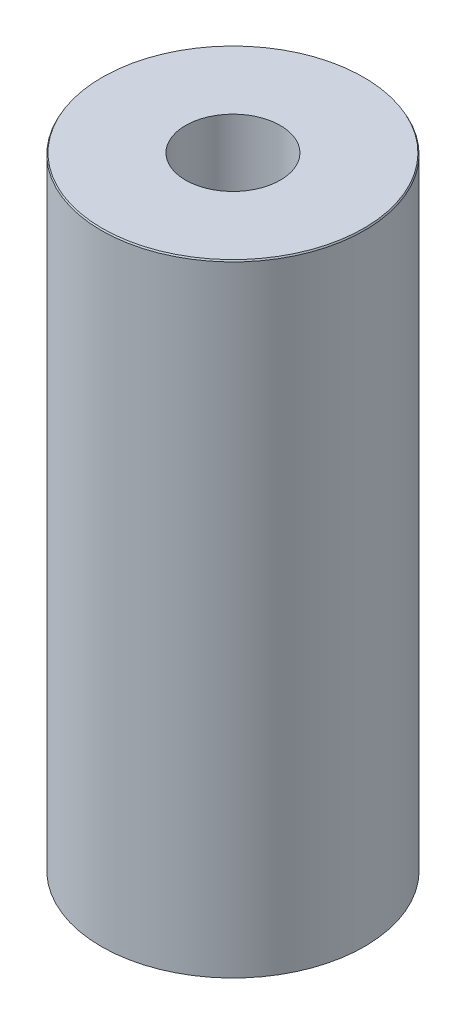
from build123d import *
from OCP.BRepFilletAPI import BRepFilletAPI_MakeChamfer

# Parameters (mm, degrees)
SKETCH1_R           = 47.5
BOSS_EXTRUDE1_DEPTH = 224.591932747
SKETCH2_R           = 17.105714804
CUT_EXTRUDE1_DEPTH  = 235.422772476
CHAMFER1_SIZE       = 0.516250917
CHAMFER1_SIZE2      = 0.298057606


with BuildPart() as part:
    # Sketch1 → Boss-Extrude1 (new body)
    with BuildSketch(Plane(origin=(0, 0, 0), x_dir=(1, 0, 0), z_dir=(0, 1, 0))):
        Circle(SKETCH1_R)
    extrude(amount=BOSS_EXTRUDE1_DEPTH)

    # Sketch2 → Cut-Extrude1 (cut, through all)
    with BuildSketch(Plane(origin=(0, 0, 0), x_dir=(1, 0, 0), z_dir=(0, 1, 0))):
        Circle(SKETCH2_R)
    extrude(amount=CUT_EXTRUDE1_DEPTH, mode=Mode.SUBTRACT)

    # Chamfer1: one chamfer whose edges measure the first distance from different faces: ONE call of the kernel's chamfer builder (chamfer() names one face for all edges)
    chamfer1_edges_1 = [part.edges().sort_by_distance(p)[0] for p in [
        (-47.5, 224.591932747, 0),
    ]]
    chamfer1_side_1 = [part.faces().sort_by_distance(p)[0] for p in [
        (-47.5, 112.295966374, 0),
    ]]
    chamfer1_edges_2 = [part.edges().sort_by_distance(p)[0] for p in [
        (-47.5, 0, 0),
    ]]
    chamfer1_side_2 = [part.faces().sort_by_distance(p)[0] for p in [
        (-46.156497116, 0, 0),
    ]]
    chamfer1 = BRepFilletAPI_MakeChamfer(part.part.solid().wrapped)
    for e in chamfer1_edges_1:
        chamfer1.Add(CHAMFER1_SIZE, CHAMFER1_SIZE2, e.wrapped, chamfer1_side_1[0].wrapped)  # the first distance lies on this face
    for e in chamfer1_edges_2:
        chamfer1.Add(CHAMFER1_SIZE, CHAMFER1_SIZE2, e.wrapped, chamfer1_side_2[0].wrapped)  # the first distance lies on this face
    add(Compound.cast(chamfer1.Shape()), mode=Mode.REPLACE)


solid = part.part
